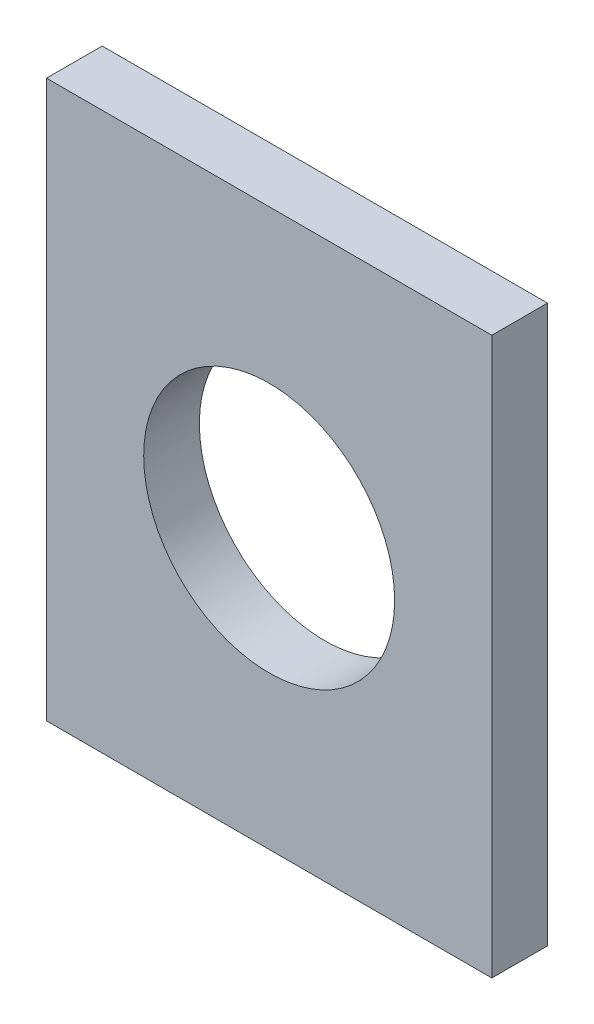
from build123d import *

# Parameters (mm, degrees)
SKETCH1_W           = 50.8
SKETCH1_H           = 63.5
SKETCH1_R           = 14.3129
BOSS_EXTRUDE1_DEPTH = 6.35


with BuildPart() as part:
    # Sketch1 → Boss-Extrude1 (new body)
    with BuildSketch(Plane.XY):
        with Locations((25.4, 31.75)):
            Rectangle(SKETCH1_W, SKETCH1_H)
        with Locations((25.4, 31.75)):
            Circle(SKETCH1_R, mode=Mode.SUBTRACT)
    extrude(amount=BOSS_EXTRUDE1_DEPTH)


solid = part.part
